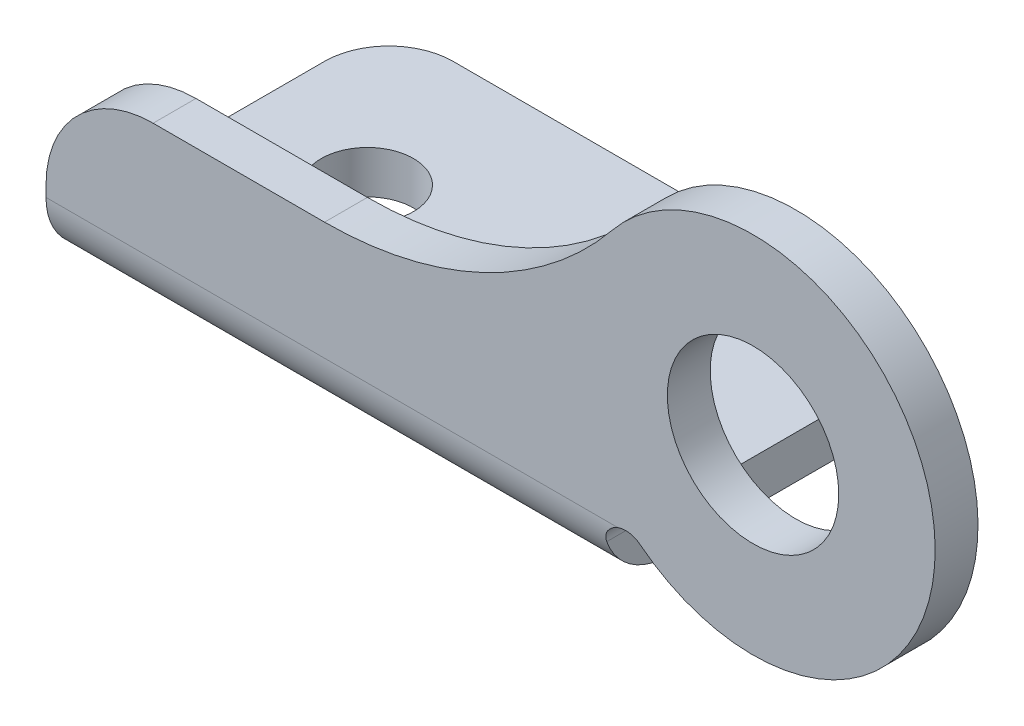
from build123d import *

# Parameters (mm, degrees)
SKETCH_1_W          = 26
SKETCH_1_H          = 16
EXTRUDE_1_DEPTH     = 2
EXTRUDE_2_DEPTH     = 2
FILLET_1_R          = 5
FILLET_2_R          = 3
SKETCH_4_R          = 4
CUT_EXTRUDE_1_DEPTH = 38.312866414
SKETCH_5_R          = 2.15
CUT_EXTRUDE_2_DEPTH = 34.648922717
FILLET_3_R          = 3
FILLET_START        = -13
FILLET_4_DEPTH      = 26.69955789
FILLET_START_2      = 4
FILLET_4_2_DEPTH    = 2


with BuildPart() as part:
    # 草图1 → 凸台-拉伸1 (new body)
    with BuildSketch(Plane(origin=(0, 0, 0), x_dir=(1, 0, 0), z_dir=(0, 1, 0))):
        Rectangle(SKETCH_1_W, SKETCH_1_H)
    extrude(amount=EXTRUDE_1_DEPTH)

    # 草图3 → 凸台-拉伸2 (add)
    with BuildSketch(Plane.XY.offset(8)):
        with BuildLine():
            Line((-13, 2), (-13, 8.5))
            Line((-13, 8.5), (0, 8.5))
            ThreePointArc((0, 8.5), (7.423811989, 10.173553708), (13.411524732, 14.870474248))
            ThreePointArc((13.411524732, 14.870474248), (28.449822139, 10.422228722), (14.725126476, 2.834738617))
            ThreePointArc((14.725126476, 2.834738617), (13.600854496, 2.958234042), (13, 2))
            Line((13, 2), (-13, 2))
        make_face()
    extrude(amount=-EXTRUDE_2_DEPTH)

    # 圆角1
    fillet_1_edges = [part.edges().sort_by_distance(p)[0] for p in [
        (-13, 8.5, 7),
    ]]
    fillet(fillet_1_edges, radius=FILLET_1_R)

    # 圆角2
    fillet_2_edges = [part.edges().sort_by_distance(p)[0] for p in [
        (-13, 1, -8),
        (13, 1, -8),
    ]]
    fillet(fillet_2_edges, radius=FILLET_2_R)

    # 草图4 → 切除-拉伸1 (cut, through all)
    with BuildSketch(Plane.XY.offset(8)):
        with Locations((20, 9.5)):
            Circle(SKETCH_4_R)
    extrude(amount=-CUT_EXTRUDE_1_DEPTH, mode=Mode.SUBTRACT)

    # 草图5 → 切除-拉伸2 (cut, through all)
    with BuildSketch(Plane(origin=(0, 2, 0), x_dir=(1, 0, 0), z_dir=(0, 1, 0))):
        with Locations(Location((-7, 1, 0), (0, 0, 270))):
            Circle(SKETCH_5_R)
        with Locations(Location((6, 1, 0), (0, 0, 270))):
            Circle(SKETCH_5_R)
    extrude(amount=-CUT_EXTRUDE_2_DEPTH, mode=Mode.SUBTRACT)

    # 圆角3
    fillet_3_edges = [part.edges().sort_by_distance(p)[0] for p in [
        (0, 0, 8),
    ]]
    fillet(fillet_3_edges, radius=FILLET_3_R)

    # 圆角4: read off the stored shape, not the designer's step
    # 圆角4 outline → 圆角4 (add)
    with BuildSketch(Plane.YZ.offset(FILLET_START)):
        with BuildLine():
            ThreePointArc((2, 5), (2.292893219, 5.707106781), (3, 6))
            Line((3, 6), (2, 6))
            Line((2, 6), (2, 5))
        make_face()
    extrude(amount=FILLET_4_DEPTH)

    # Fillet 4 2 outline → Fillet 4 2 (cut)
    with BuildSketch(Plane.XY.offset(FILLET_START_2)):
        with BuildLine():
            Line((13.69955789, 2), (13.699557878, 3.000000032))
            ThreePointArc((13.699557878, 3.000000032), (13.19224914, 2.610200695), (13, 1.999999133))
            Line((13, 1.999999133), (13.69955789, 2))
        make_face()
    extrude(amount=FILLET_4_2_DEPTH, mode=Mode.SUBTRACT)


solid = part.part
